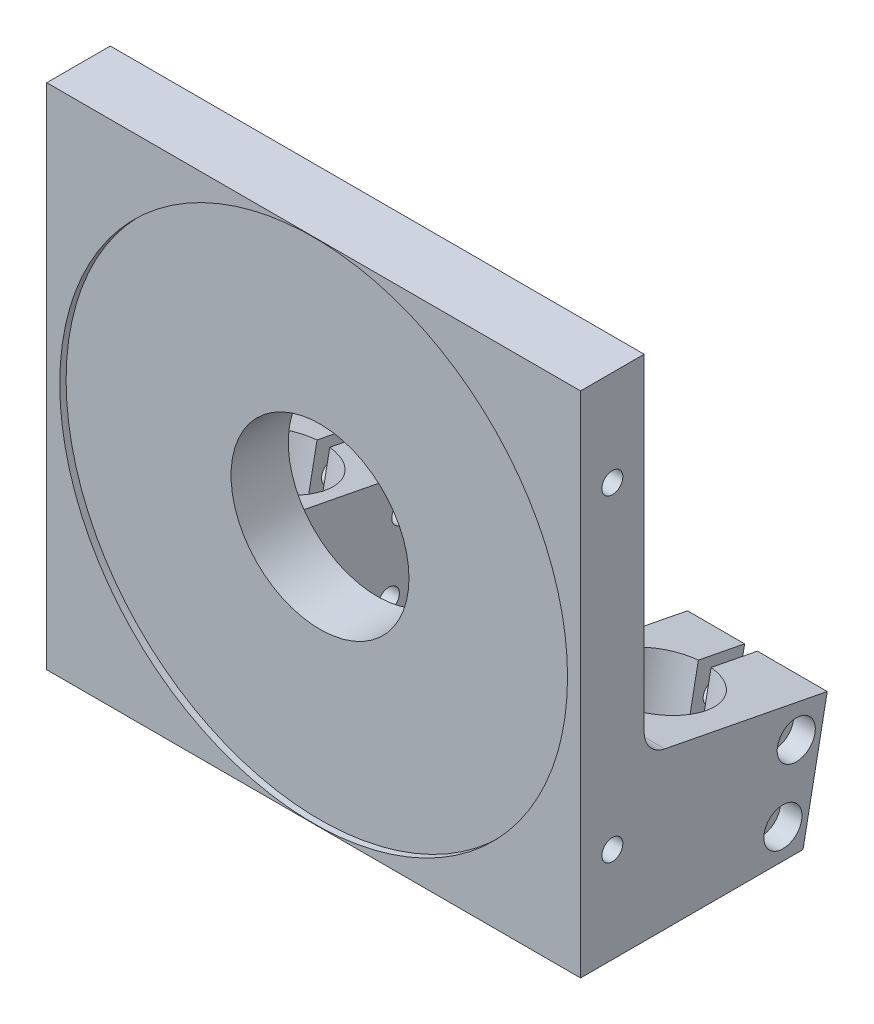
from build123d import *

# Parameters (mm, degrees)
SKETCH_1_W                  = 84
SKETCH_1_H                  = 80
SKETCH_1_R                  = 14
EXTRUDE_1_DEPTH             = 5
HOLE_WIZARD_M4_1_AT_2_COUNT = 2
HOLE_WIZARD_M4_1_AT_2_PITCH = 50
EXTRUDE_2_DEPTH             = 22
CUT_EXTRUDE_3_REACH         = 79
HOLE_START                  = -42
HOLE_WIZARD_2_OUTLINE_R     = 1.7
HOLE_WIZARD_2_DEPTH         = 11
HOLE_WIZARD_2_2_OUTLINE_R   = 3
HOLE_WIZARD_2_2_OUTLINE_R_2 = 1.7
HOLE_WIZARD_2_2_DEPTH       = 3.4
HOLE_WIZARD_M4_2_D          = 3.3
FILLET_1_R                  = 4
SKETCH_14_R                 = 39.95
CUT_EXTRUDE_6_DEPTH         = 1


# Read off the part's stored shape, not the designer's step: 打孔尺寸(%根据)内六角圆柱头螺钉的类型2
with BuildPart() as part:
    # 草图1 → 凸台-拉伸1 (new, symmetric)
    with BuildSketch(Plane.XY):
        Rectangle(SKETCH_1_W, SKETCH_1_H)
        Circle(SKETCH_1_R, mode=Mode.SUBTRACT)
    extrude(amount=EXTRUDE_1_DEPTH, both=True)

    # 草图4 → M4 螺纹孔1 (revolve, cut)
    with BuildSketch(Plane(origin=(-42, 25, 0), x_dir=(0, 0, 1), z_dir=(0, 1, 0))):
        Polygon((0, 0), (0, 14.491420021), (1.65, 13.5), (1.65, 0), align=None)
    hole_wizard_m4_1 = revolve(axis=Axis((-48.35, 25, 0), (1, 0, 0)), mode=Mode.SUBTRACT)

    # M4 螺纹孔1 at 2: M4 螺纹孔1 ×2
    with Locations(*[(0, -i * HOLE_WIZARD_M4_1_AT_2_PITCH, 0) for i in range(1, HOLE_WIZARD_M4_1_AT_2_COUNT)]):
        add(hole_wizard_m4_1, mode=Mode.SUBTRACT)

    # 草图6 → 凸台-拉伸2 (add)
    with BuildSketch(Plane.ZY.offset(42)):
        Polygon((-5, -14.766158372), (-5, -40), (-30, -40), (-33.816179908, -20.367456331), align=None)
    extrude_2 = extrude(amount=-EXTRUDE_2_DEPTH)

    # 切除-拉伸3: up to this plane
    cut_extrude_3_end = Plane(origin=(-42, -40, 5), z_dir=(0, 1, 0))
    # 草图7 → 切除-拉伸3 (cut, up to the surface)
    with BuildSketch(Plane(origin=(0, -13.292034521, 2.583709779), x_dir=(1, 0, 0), z_dir=(0, 0.9816271834476648, -0.19080899537654153)), mode=Mode.PRIVATE) as cut_extrude_3_sk1:
        with BuildLine():
            Line((-31, 37.081175318), (-29, 37.081175318))
            Line((-29, 37.081175318), (-29, 29.662905695))
            ThreePointArc((-29, 29.662905695), (-30, 13.725651762), (-31, 29.662905695))
            Line((-31, 29.662905695), (-31, 37.081175318))
        make_face()
    cut_extrude_3_tool1 = split(extrude(cut_extrude_3_sk1.sketch, amount=-CUT_EXTRUDE_3_REACH, mode=Mode.PRIVATE), bisect_by=cut_extrude_3_end, keep=Keep.BOTH, mode=Mode.PRIVATE)
    cut_extrude_3 = cut_extrude_3_tool1.solids().sort_by_distance((-30, -17.589666, -19.525688))[0]
    add(cut_extrude_3, mode=Mode.SUBTRACT)

    # 打孔尺寸(%根据)内六角圆柱头螺钉的类型2 outline → 打孔尺寸(%根据)内六角圆柱头螺钉的类型2 (cut)
    with BuildSketch(Plane.YZ.offset(HOLE_START)):
        with Locations((-35.310255285, -26.836727248)):
            Circle(HOLE_WIZARD_2_OUTLINE_R)
        with Locations((-24.512356267, -28.935626197)):
            Circle(HOLE_WIZARD_2_OUTLINE_R)
    hole_wizard_2 = extrude(amount=HOLE_WIZARD_2_DEPTH, mode=Mode.SUBTRACT)

    # Hole Wizard 2 2 outline → Hole Wizard 2 2 (cut)
    # profile 1 of 2: a face of its own
    with BuildSketch(Plane.YZ.offset(HOLE_START)):
        with Locations((-35.310255285, -26.836727248)):
            Circle(HOLE_WIZARD_2_2_OUTLINE_R)
        with Locations((-35.310255285, -26.836727248)):
            Circle(HOLE_WIZARD_2_2_OUTLINE_R_2, mode=Mode.SUBTRACT)
    # profile 2 of 2: a face of its own
    with BuildSketch(Plane.YZ.offset(HOLE_START)):
        with Locations((-24.512356267, -28.935626197)):
            Circle(HOLE_WIZARD_2_2_OUTLINE_R)
        with Locations((-24.512356267, -28.935626197)):
            Circle(HOLE_WIZARD_2_2_OUTLINE_R_2, mode=Mode.SUBTRACT)
    hole_wizard_2_2 = extrude(amount=HOLE_WIZARD_2_2_DEPTH, mode=Mode.SUBTRACT)

    # M4 螺纹孔2 (through all)
    with Locations(Plane(origin=(-20, 0, 0), x_dir=(0, 0, -1), z_dir=(1, 0, 0))):
        with Locations((28.935626197, -24.512356267), (26.836727248, -35.310255285)):
            hole_wizard_m4_2 = Hole(HOLE_WIZARD_M4_2_D / 2)

    # 镜向1: M4 螺纹孔1, 凸台-拉伸2, 切除-拉伸3, 打孔尺寸(%根据)内六角圆柱头螺钉的类型2, Hole Wizard 2 2, M4 螺纹孔2 across plane
    add(hole_wizard_m4_1.mirror(Plane(origin=(0, 0, 0), x_dir=(0, 0, 1), z_dir=(1, 0, 0))), mode=Mode.SUBTRACT)
    add(extrude_2.mirror(Plane(origin=(0, 0, 0), x_dir=(0, 0, 1), z_dir=(1, 0, 0))))
    add(cut_extrude_3.mirror(Plane(origin=(0, 0, 0), x_dir=(0, 0, 1), z_dir=(1, 0, 0))), mode=Mode.SUBTRACT)
    add(hole_wizard_2.mirror(Plane(origin=(0, 0, 0), x_dir=(0, 0, 1), z_dir=(1, 0, 0))), mode=Mode.SUBTRACT)
    add(hole_wizard_2_2.mirror(Plane(origin=(0, 0, 0), x_dir=(0, 0, 1), z_dir=(1, 0, 0))), mode=Mode.SUBTRACT)
    add(hole_wizard_m4_2.mirror(Plane(origin=(0, 0, 0), x_dir=(0, 0, 1), z_dir=(1, 0, 0))), mode=Mode.SUBTRACT)

    # 镜向1 copy 1 sketch → 镜向1 copy 1 (revolve, cut)
    with BuildSketch(Plane(origin=(42, -25, 0), x_dir=(0, 0, 1), z_dir=(0, 1, 0))):
        Polygon((0, 0), (0, -14.491420021), (1.65, -13.5), (1.65, 0), align=None)
    revolve(axis=Axis((48.35, -25, 0), (1, 0, 0)), mode=Mode.SUBTRACT)

    # 圆角1
    fillet_1_edges = [part.edges().sort_by_distance(p)[0] for p in [
        (-31, -14.766158372, -5),
        (31, -14.766158372, -5),
    ]]
    fillet(fillet_1_edges, radius=FILLET_1_R)

    # 草图14 → 切除-拉伸6 (cut)
    with BuildSketch(Plane.XY.offset(5)):
        Circle(SKETCH_14_R)
    extrude(amount=-CUT_EXTRUDE_6_DEPTH, mode=Mode.SUBTRACT)


solid = part.part
